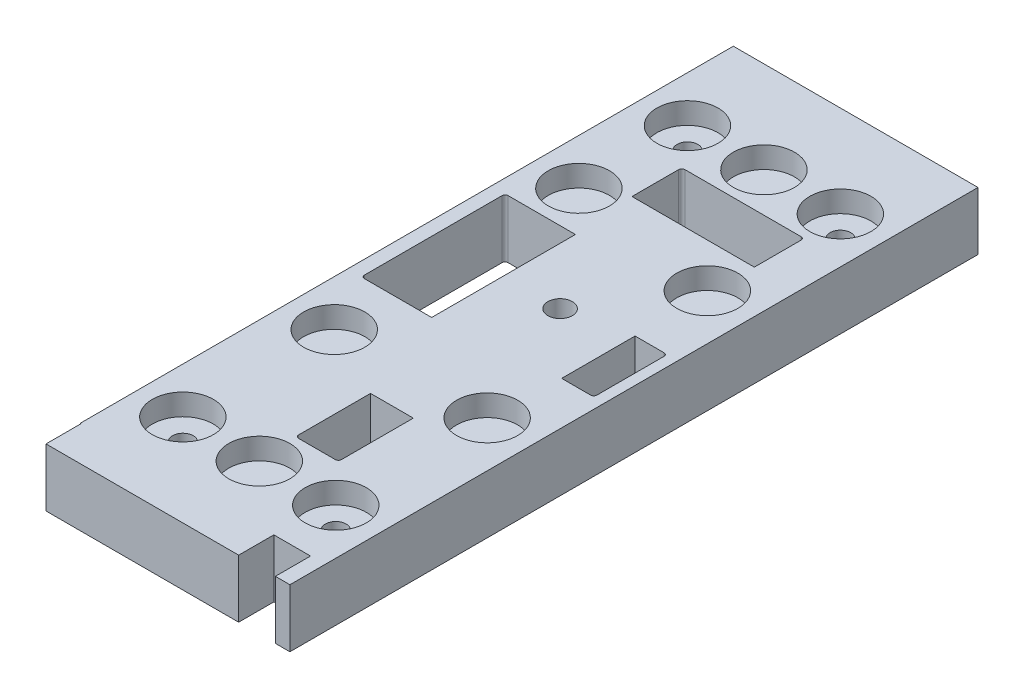
from build123d import *

# Parameters (mm, degrees)
SKETCH1_W           = 80
SKETCH1_H           = 225
BOSS_EXTRUDE1_DEPTH = 19
CUT_EXTRUDE1_REACH  = 122.902
SKETCH4_R           = 10
CUT_EXTRUDE2_DEPTH  = 7
SKETCH5_R           = 8.5
CUT_EXTRUDE3_DEPTH  = 5
CUT_EXTRUDE4_REACH  = 122.902
SKETCH7_W           = 12
SKETCH7_H           = 11.5
SKETCH7_W_2         = 1
M8_TAPPED_HOLE1_D   = 6.8
SKETCH11_R          = 4
CUT_EXTRUDE5_DEPTH  = 121.901819672


with BuildPart() as part:
    # Sketch1 → Boss-Extrude1 (new body)
    with BuildSketch(Plane(origin=(0, 0, 0), x_dir=(1, 0, 0), z_dir=(0, 1, 0))):
        Rectangle(SKETCH1_W, SKETCH1_H)
    extrude(amount=-BOSS_EXTRUDE1_DEPTH)

    # Sketch2 → Cut-Extrude1 (cut, up to next)
    with BuildSketch(Plane(origin=(0, 0, 0), x_dir=(1, 0, 0), z_dir=(0, 1, 0)), mode=Mode.PRIVATE) as cut_extrude1_sk1:
        with BuildLine():
            Line((-34.5, -13.64), (-12.5, -13.64))
            Line((-12.5, -13.64), (-12.5, 33.36))
            Line((-12.5, 33.36), (-34.5, 33.36))
            ThreePointArc((-34.5, 33.36), (-35.207106781, 33.067106781), (-35.5, 32.36))
            Line((-35.5, 32.36), (-35.5, -12.64))
            ThreePointArc((-35.5, -12.64), (-35.207106781, -13.347106781), (-34.5, -13.64))
        make_face()
    cut_extrude1_tool1 = extrude(cut_extrude1_sk1.sketch, amount=-CUT_EXTRUDE1_REACH, mode=Mode.PRIVATE) & part.part
    # Sketch2 → Cut-Extrude1 (cut, up to next)
    with BuildSketch(Plane(origin=(0, 0, 0), x_dir=(1, 0, 0), z_dir=(0, 1, 0)), mode=Mode.PRIVATE) as cut_extrude1_sk2:
        with BuildLine():
            Line((0, -69.64), (12, -69.64))
            ThreePointArc((12, -69.64), (12.707106781, -69.347106781), (13, -68.64))
            Line((13, -68.64), (13, -45.14))
            Line((13, -45.14), (-1, -45.14))
            Line((-1, -45.14), (-1, -68.64))
            ThreePointArc((-1, -68.64), (-0.707106781, -69.347106781), (0, -69.64))
        make_face()
    cut_extrude1_tool2 = extrude(cut_extrude1_sk2.sketch, amount=-CUT_EXTRUDE1_REACH, mode=Mode.PRIVATE) & part.part
    # Sketch2 → Cut-Extrude1 (cut, up to next)
    with BuildSketch(Plane(origin=(0, 0, 0), x_dir=(1, 0, 0), z_dir=(0, 1, 0)), mode=Mode.PRIVATE) as cut_extrude1_sk3:
        with BuildLine():
            Line((35.5, 14.36), (26, 14.36))
            Line((26, 14.36), (26, -9.64))
            Line((26, -9.64), (35.5, -9.64))
            ThreePointArc((35.5, -9.64), (36.207106781, -9.347106781), (36.5, -8.64))
            Line((36.5, -8.64), (36.5, 13.36))
            ThreePointArc((36.5, 13.36), (36.207106781, 14.067106781), (35.5, 14.36))
        make_face()
    cut_extrude1_tool3 = extrude(cut_extrude1_sk3.sketch, amount=-CUT_EXTRUDE1_REACH, mode=Mode.PRIVATE) & part.part
    # Sketch2 → Cut-Extrude1 (cut, up to next)
    with BuildSketch(Plane(origin=(0, 0, 0), x_dir=(1, 0, 0), z_dir=(0, 1, 0)), mode=Mode.PRIVATE) as cut_extrude1_sk4:
        with BuildLine():
            Line((26, 53.36), (26, 68.64))
            ThreePointArc((26, 68.64), (25.707106781, 69.347106781), (25, 69.64))
            Line((25, 69.64), (-13, 69.64))
            ThreePointArc((-13, 69.64), (-13.707106781, 69.347106781), (-14, 68.64))
            Line((-14, 68.64), (-14, 53.36))
            Line((-14, 53.36), (26, 53.36))
        make_face()
    cut_extrude1_tool4 = extrude(cut_extrude1_sk4.sketch, amount=-CUT_EXTRUDE1_REACH, mode=Mode.PRIVATE) & part.part
    add(cut_extrude1_tool1.solids().sort_by_distance((-23.995521, 0, -9.86))[0], mode=Mode.SUBTRACT)
    add(cut_extrude1_tool2.solids().sort_by_distance((6, 0, 57.374932))[0], mode=Mode.SUBTRACT)
    add(cut_extrude1_tool3.solids().sort_by_distance((31.241424, 0, -2.36))[0], mode=Mode.SUBTRACT)
    add(cut_extrude1_tool4.solids().sort_by_distance((6, 0, -61.494779))[0], mode=Mode.SUBTRACT)

    # Sketch4 → Cut-Extrude2 (cut)
    with BuildSketch(Plane(origin=(0, 0, 0), x_dir=(1, 0, 0), z_dir=(0, 1, 0))):
        with Locations((25, -82.5)):
            Circle(SKETCH4_R)
        with Locations((0, -82.5)):
            Circle(SKETCH4_R)
        with Locations((-25, -82.5)):
            Circle(SKETCH4_R)
        with Locations((-25, -33)):
            Circle(SKETCH4_R)
        with Locations((25, -33)):
            Circle(SKETCH4_R)
        with Locations((25, 39)):
            Circle(SKETCH4_R)
        with Locations((-25, 47)):
            Circle(SKETCH4_R)
        with Locations((-25, 82.5)):
            Circle(SKETCH4_R)
        with Locations((0, 82.5)):
            Circle(SKETCH4_R)
        with Locations((25, 82.5)):
            Circle(SKETCH4_R)
    extrude(amount=-CUT_EXTRUDE2_DEPTH, mode=Mode.SUBTRACT)

    # Sketch5 → Cut-Extrude3 (cut)
    with BuildSketch(Plane.XZ.offset(19)):
        with Locations((6, 100)):
            Circle(SKETCH5_R)
        with Locations((6, -100)):
            Circle(SKETCH5_R)
    extrude(amount=-CUT_EXTRUDE3_DEPTH, mode=Mode.SUBTRACT)

    # Sketch7 → Cut-Extrude4 (cut, up to next)
    with BuildSketch(Plane(origin=(0, 0, 0), x_dir=(1, 0, 0), z_dir=(0, 1, 0)), mode=Mode.PRIVATE) as cut_extrude4_sk1:
        with Locations((29.25, -106.75)):
            Rectangle(SKETCH7_W, SKETCH7_H)
    cut_extrude4_tool1 = extrude(cut_extrude4_sk1.sketch, amount=-CUT_EXTRUDE4_REACH, mode=Mode.PRIVATE) & part.part
    # Sketch7 → Cut-Extrude4 (cut, up to next)
    with BuildSketch(Plane(origin=(0, 0, 0), x_dir=(1, 0, 0), z_dir=(0, 1, 0)), mode=Mode.PRIVATE) as cut_extrude4_sk2:
        with Locations((-40.25, -106.75)):
            Rectangle(SKETCH7_W_2, SKETCH7_H)
    cut_extrude4_tool2 = extrude(cut_extrude4_sk2.sketch, amount=-CUT_EXTRUDE4_REACH, mode=Mode.PRIVATE) & part.part
    add(cut_extrude4_tool1.solids().sort_by_distance((29.25, 0, 106.75))[0], mode=Mode.SUBTRACT)
    add(cut_extrude4_tool2.solids().sort_by_distance((-40.25, 0, 106.75))[0], mode=Mode.SUBTRACT)

    # M8 Tapped Hole1 (through all)
    with Locations(Plane(origin=(0, 0, 0), x_dir=(1, 0, 0), z_dir=(0, 1, 0))):
        with Locations((-25, 82.5), (25, 82.5), (25, -82.5), (-25, -82.5)):
            Hole(M8_TAPPED_HOLE1_D / 2)

    # Sketch11 → Cut-Extrude5 (cut, through all)
    with BuildSketch(Plane(origin=(0, 0, 0), x_dir=(1, 0, 0), z_dir=(0, 1, 0))):
        with Locations((6, 9.86)):
            Circle(SKETCH11_R)
    extrude(amount=-CUT_EXTRUDE5_DEPTH, mode=Mode.SUBTRACT)


solid = part.part
